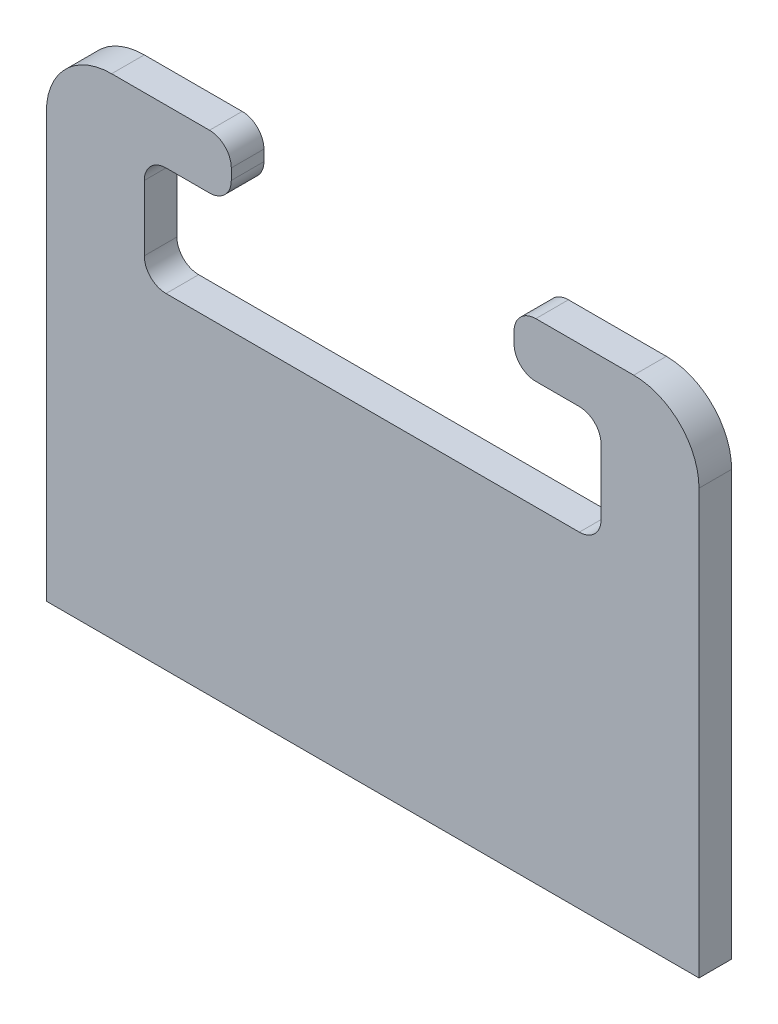
from build123d import *

# Parameters (mm, degrees)
EXTRUDE_1_DEPTH = 3
FILLET_1_R      = 6
FILLET_2_R      = 2


with BuildPart() as part:
    # 草图1 → 凸台-拉伸1 (new body)
    with BuildSketch(Plane.XY):
        Polygon((13, 22.5), (30, 22.5), (30, -22.5), (-30, -22.5), (-30, 22.5), (-13, 22.5), (-13, 17.5), (-21, 17.5), (-21, 7.5), (21, 7.5), (21, 17.5), (13, 17.5), align=None)
    extrude(amount=EXTRUDE_1_DEPTH)

    # 圆角1
    fillet_1_edges = [part.edges().sort_by_distance(p)[0] for p in [
        (30, 22.5, 1.5),
        (-30, 22.5, 1.5),
    ]]
    fillet(fillet_1_edges, radius=FILLET_1_R)

    # 圆角2
    fillet_2_edges = [part.edges().sort_by_distance(p)[0] for p in [
        (21, 17.5, 1.5),
        (21, 7.5, 1.5),
        (-21, 7.5, 1.5),
        (-21, 17.5, 1.5),
        (-13, 17.5, 1.5),
        (-13, 22.5, 1.5),
        (13, 17.5, 1.5),
        (13, 22.5, 1.5),
    ]]
    fillet(fillet_2_edges, radius=FILLET_2_R)


solid = part.part
